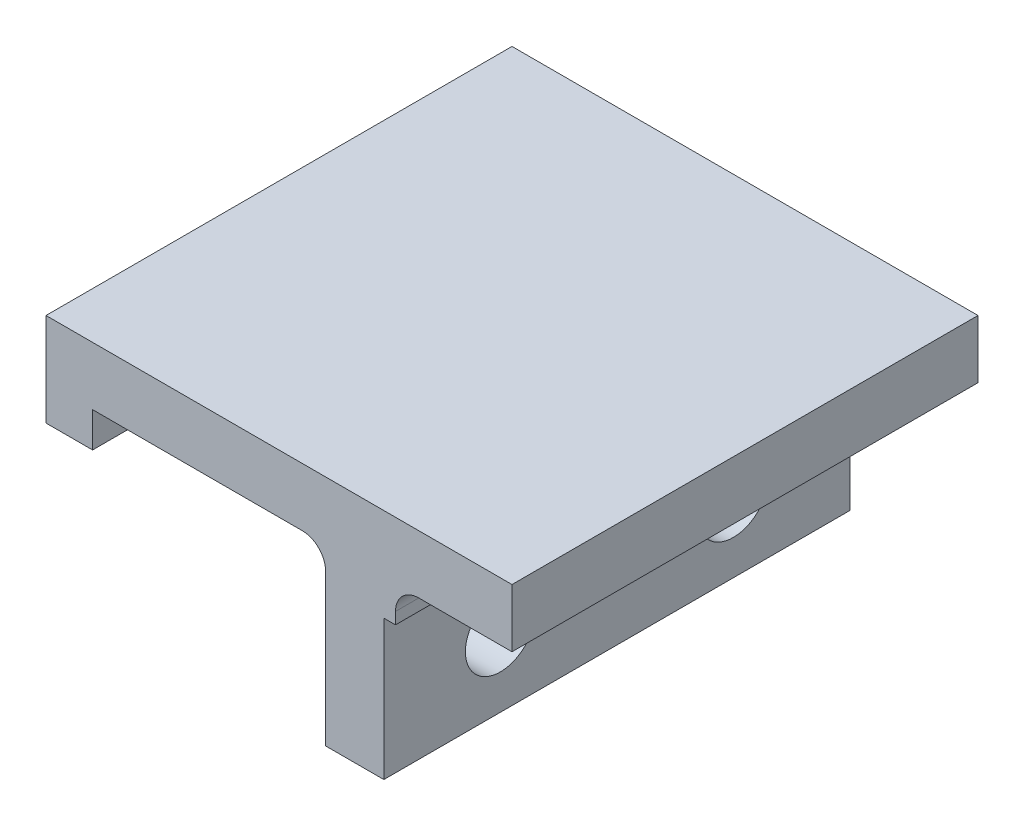
from build123d import *

# Parameters (mm, degrees)
SZKIC1_W                    = 40
SZKIC1_H                    = 15
SZKIC1_R                    = 3
DODANIE_WYCI_GNI_CIE1_DEPTH = 6
SZKIC2_W                    = 40
SZKIC2_H                    = 40
DODANIE_WYCI_GNI_CIE2_DEPTH = 5
SZKIC3_W                    = 40
SZKIC3_H                    = 12
WYTNIJ_WYCI_GNI_CIE1_DEPTH  = 1
ZAOKR_GLENIE1_R             = 2
SZKIC4_W                    = 4
SZKIC4_H                    = 40
DODANIE_WYCI_GNI_CIE3_DEPTH = 3


with BuildPart() as part:
    # Szkic1 → Dodanie-wyciągnięcie1 (new body)
    with BuildSketch(Plane(origin=(0, 0, 0), x_dir=(0, 0, -1), z_dir=(1, 0, 0))):
        with Locations((-10, 1.5)):
            Rectangle(SZKIC1_W, SZKIC1_H)
        Circle(SZKIC1_R, mode=Mode.SUBTRACT)
        with Locations((-20, 0)):
            Circle(SZKIC1_R, mode=Mode.SUBTRACT)
    extrude(amount=DODANIE_WYCI_GNI_CIE1_DEPTH)

    # Szkic2 → Dodanie-wyciągnięcie2 (add)
    with BuildSketch(Plane(origin=(0, 9, 0), x_dir=(1, 0, 0), z_dir=(0, 1, 0))):
        with Locations((-4, -10)):
            Rectangle(SZKIC2_W, SZKIC2_H)
    extrude(amount=DODANIE_WYCI_GNI_CIE2_DEPTH)

    # Szkic3 → Wytnij-wyciągnięcie1 (cut)
    with BuildSketch(Plane(origin=(6, 0, 0), x_dir=(0, 0, -1), z_dir=(1, 0, 0))):
        with Locations((-10, 0)):
            Rectangle(SZKIC3_W, SZKIC3_H)
    extrude(amount=-WYTNIJ_WYCI_GNI_CIE1_DEPTH, mode=Mode.SUBTRACT)

    # Zaokrąglenie1
    zaokr_glenie1_edges = [part.edges().sort_by_distance(p)[0] for p in [
        (0, 9, 10),
        (6, 9, 10),
    ]]
    fillet(zaokr_glenie1_edges, radius=ZAOKR_GLENIE1_R)

    # Szkic4 → Dodanie-wyciągnięcie3 (add)
    with BuildSketch(Plane.XZ.offset(-9)):
        with Locations((-22, 10)):
            Rectangle(SZKIC4_W, SZKIC4_H)
    extrude(amount=DODANIE_WYCI_GNI_CIE3_DEPTH)


solid = part.part
